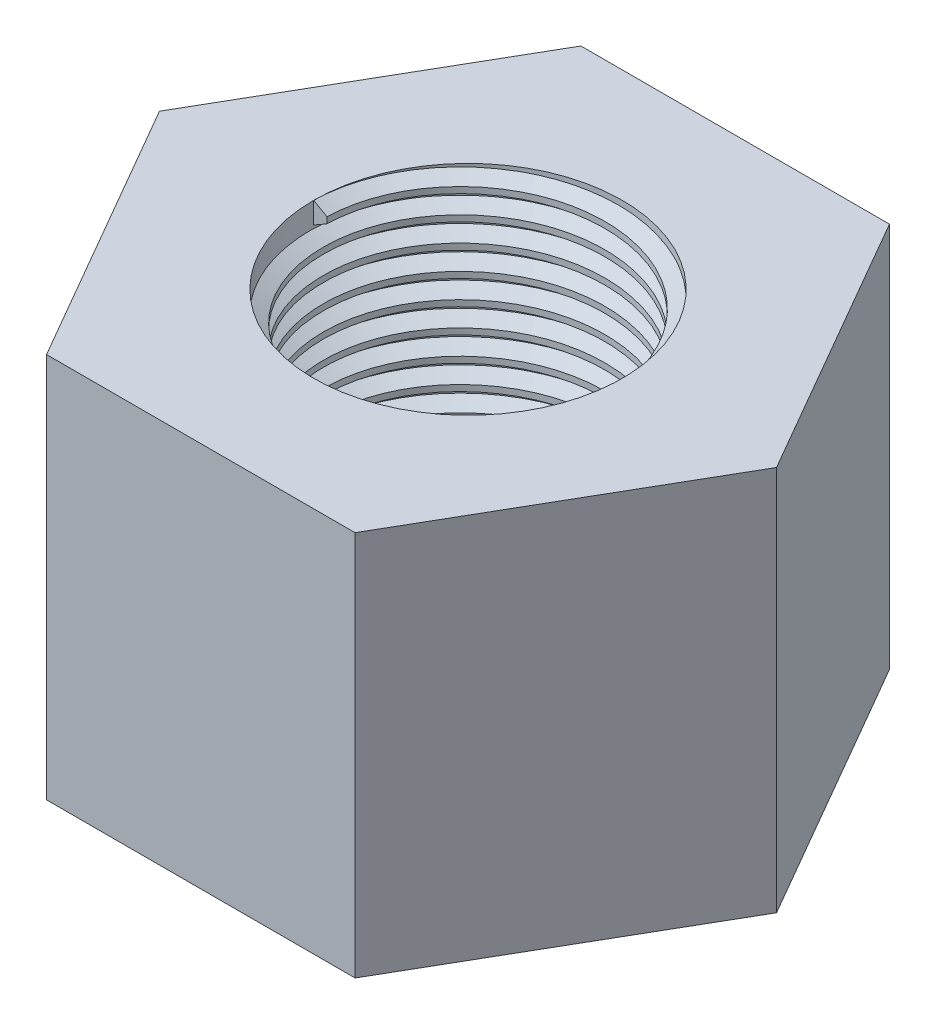
from build123d import *

# Parameters (mm, degrees)
SKETCH1_R           = 2
BOSS_EXTRUDE1_DEPTH = 5
THREAD1_PITCH       = 0.3175
SKETCH8_W           = 8
SKETCH8_H           = 2
CUT_EXTRUDE1_DEPTH  = 10.434073101


with BuildPart() as part:
    # Sketch1 → Boss-Extrude1 (new body)
    with BuildSketch(Plane(origin=(0, 0, 0), x_dir=(1, 0, 0), z_dir=(0, 1, 0))):
        Polygon((2, 3.464101615), (-2, 3.464101615), (-4, 0), (-2, -3.464101615), (2, -3.464101615), (4, 0), align=None)
        with Locations(Location((0, 0, 0), (0, 0, 270))):
            Circle(SKETCH1_R, mode=Mode.SUBTRACT)
    extrude(amount=BOSS_EXTRUDE1_DEPTH)

    # Thread1: the profile of Thread Profile3 profile screwed along a right-hand helix of 15.748031 turns, 6 arcs to a turn; built about Z, then put on its axis
    thread1_z = Axis((0, 0, 0), (0, 0, 1))
    thread1_corners = [(2.0003, 0, -0.000173205), (2.0003, 0, 0.277985704), (1.828148085, 0, 0.17859375), (1.828148085, 0, 0.09921875)]
    with BuildLine(mode=Mode.PRIVATE) as thread1_profile:
        Line(thread1_corners[0], thread1_corners[1])
        Line(thread1_corners[1], thread1_corners[2])
        Line(thread1_corners[2], thread1_corners[3])
        Line(thread1_corners[3], thread1_corners[0])
    thread1_cap = Face(thread1_profile.wire())
    thread1_turn_angles = [0, 30, 60, 90, 120, 150, 180, 210, 240, 270, 300, 330, 360]
    thread1_turn_weights = [1, 0.8660254037844387, 1, 0.8660254037844387, 1, 0.8660254037844387, 1, 0.8660254037844387, 1, 0.8660254037844387, 1, 0.8660254037844387, 1]
    thread1_turn_rails = [Edge.make_bspline([Vector(p[0], p[1], 0).rotate(thread1_z, thread1_turn_angles[k]) / thread1_turn_weights[k] + Vector(0, 0, p[2] + THREAD1_PITCH * thread1_turn_angles[k] / 360) for k in range(13)], [0, 0, 0, 1, 1, 2, 2, 3, 3, 4, 4, 5, 5, 6, 6, 6], 2, thread1_turn_weights) for p in thread1_corners]
    thread1_turn_sides = [Face.make_surface_from_curves(thread1_turn_rails[p[0]], thread1_turn_rails[p[1]]) for p in [(0, 1), (1, 2), (2, 3), (3, 0)]]
    thread1_last_angles = [5400, 5430, 5460, 5490, 5520, 5550, 5580, 5610, 5640, 5654.645669291, 5669.291338583]
    thread1_last_weights = [1, 0.8660254037844387, 1, 0.8660254037844387, 1, 0.8660254037844387, 1, 0.8660254037844387, 1, 0.9675079437748935, 1]
    thread1_last_rails = [Edge.make_bspline([Vector(p[0], p[1], 0).rotate(thread1_z, thread1_last_angles[k]) / thread1_last_weights[k] + Vector(0, 0, p[2] + THREAD1_PITCH * thread1_last_angles[k] / 360) for k in range(11)], [0, 0, 0, 1, 1, 2, 2, 3, 3, 4, 4, 5, 5, 5], 2, thread1_last_weights) for p in thread1_corners]
    thread1_last_sides = [Face.make_surface_from_curves(thread1_last_rails[p[0]], thread1_last_rails[p[1]]) for p in [(0, 1), (1, 2), (2, 3), (3, 0)]]
    thread1 = Plane(origin=(0, 5, 0), x_dir=(-1, 0, 0), z_dir=(0, -1, 0)) * Solid(Shell([*[p.moved(Location((0, 0, THREAD1_PITCH * i))) for i in range(15) for p in thread1_turn_sides], *thread1_last_sides, thread1_cap, thread1_cap.rotate(thread1_z, 5669.291338583).moved(Location((0, 0, THREAD1_PITCH * 5669.291338583 / 360)))]))
    add(thread1)

    # Sketch8 → Cut-Extrude1 (cut, through all)
    with BuildSketch(Plane(origin=(0, 0, -3.464101615), x_dir=(-1, 0, 0), z_dir=(0, 0, -1))):
        with Locations((0, -1)):
            Rectangle(SKETCH8_W, SKETCH8_H)
    extrude(amount=-CUT_EXTRUDE1_DEPTH, mode=Mode.SUBTRACT)


solid = part.part
